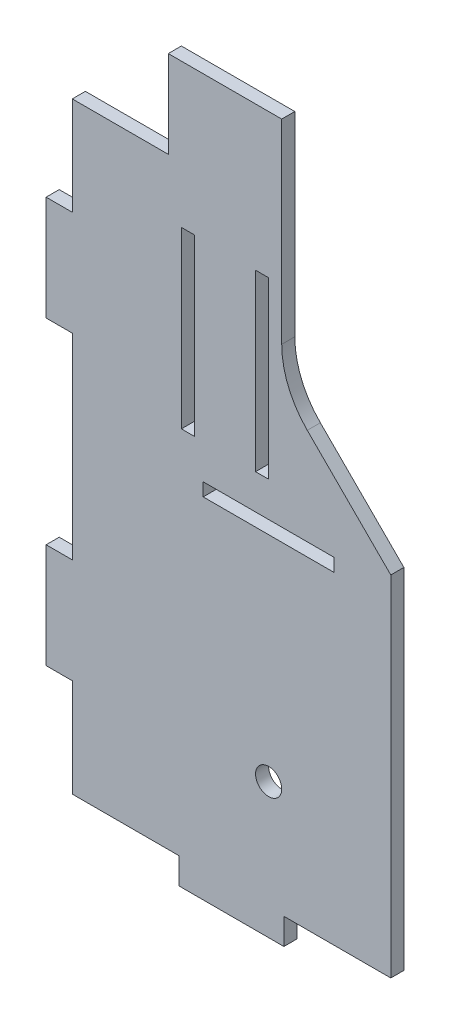
from build123d import *

# Parameters (mm, degrees)
BASESHAPE_DEPTH   = 3
SKETCH2_R         = 3
SHAFTHOLES_DEPTH  = 157.147366292
SKETCH4_W         = 6
SKETCH4_H         = 24
SKETCH4_W_2       = 24
SKETCH4_H_2       = 6
FINGERS_DEPTH     = 3
SKETCH5_W         = 30
SKETCH5_H         = 3
SKETCH5_W_2       = 3
SKETCH5_H_2       = 40
GROOVES_DEPTH     = 160.040875249
CHAMFER1_SIZE     = 25
FILLET2_R         = 20
SKETCH6_W         = 26
SKETCH6_H         = 3
MARBLECHUTE_DEPTH = 20


with BuildPart() as part:
    # Sketch1 → BaseShape (new body)
    with BuildSketch(Plane.XY):
        Polygon((-73, 138), (-73, 0), (0, 0), (0, 77), (-31, 77), (-31, 138), align=None)
    extrude(amount=BASESHAPE_DEPTH)

    # Sketch2 → ShaftHoles (cut, through all)
    with BuildSketch(Plane.XY.offset(3)):
        with Locations((-28, 25)):
            Circle(SKETCH2_R)
    extrude(amount=-SHAFTHOLES_DEPTH, mode=Mode.SUBTRACT)

    # Sketch4 → Fingers (add)
    with BuildSketch(Plane.XY.offset(3)):
        Polygon((0, 77), (-31, 77), (-31, 80), (-31, 138), (-25, 138), (-25, 80), (0, 80), align=None)
        with Locations((-76, 103.5)):
            Rectangle(SKETCH4_W, SKETCH4_H)
        with Locations((-76, 34.5)):
            Rectangle(SKETCH4_W, SKETCH4_H)
        with Locations((-36.5, -3)):
            Rectangle(SKETCH4_W_2, SKETCH4_H_2)
    extrude(amount=-FINGERS_DEPTH)

    # Sketch5 → Grooves (cut, through all)
    with BuildSketch(Plane.XY.offset(3)):
        with Locations((-28, 75.5)):
            Rectangle(SKETCH5_W, SKETCH5_H)
        with Locations((-46.5, 105)):
            Rectangle(SKETCH5_W_2, SKETCH5_H_2)
        with Locations((-29.5, 105)):
            Rectangle(SKETCH5_W_2, SKETCH5_H_2)
    extrude(amount=-GROOVES_DEPTH, mode=Mode.SUBTRACT)

    # Chamfer1
    chamfer1_edges = [part.edges().sort_by_distance(p)[0] for p in [
        (-25, 80, 1.5),
    ]]
    chamfer(chamfer1_edges, length=CHAMFER1_SIZE - 0.0001)  # a hair under: the kernel refuses the full size

    # Fillet2
    fillet2_edges = [part.edges().sort_by_distance(p)[0] for p in [
        (-25, 104.9999, 1.5),
    ]]
    fillet(fillet2_edges, radius=FILLET2_R)

    # Sketch6 → MarbleChute (add)
    with BuildSketch(Plane(origin=(0, 138, 0), x_dir=(1, 0, 0), z_dir=(0, 1, 0))):
        with Locations((-38, -1.5)):
            Rectangle(SKETCH6_W, SKETCH6_H)
    extrude(amount=MARBLECHUTE_DEPTH)


solid = part.part
